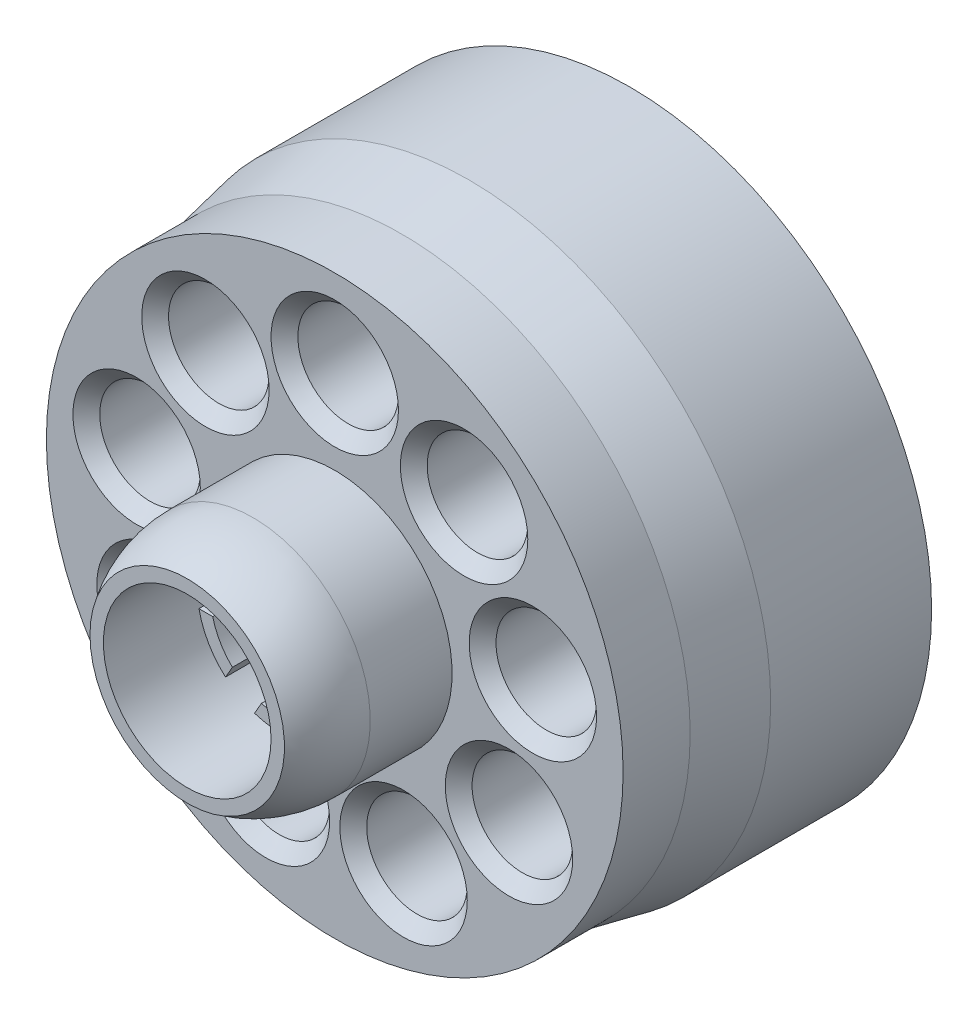
from build123d import *

# Parameters (mm, degrees)
SKETCH_1_R                           = 37.5
EXTRUDE_1_DEPTH                      = 2
SKETCH_2_R                           = 45
EXTRUDE_2_DEPTH                      = 24
SKETCH_3_R                           = 43
EXTRUDE_3_DEPTH                      = 10
SKETCH_4_R                           = 43
EXTRUDE_4_DEPTH                      = 10
SKETCH_7_R                           = 7.5
CUT_EXTRUDE_1_DEPTH                  = 36
SKETCH_8_R                           = 3
CUT_EXTRUDE_2_DEPTH                  = 87.104587567
CHAMFER_1_SIZE                       = 2
PATTERN_CIRCULAR_1_COUNT             = 9
CHAMFER_1_OF_PATTERN_CIRCULAR_1_SIZE = 2
SKETCH_9_R                           = 12.5
CUT_EXTRUDE_3_DEPTH                  = 14
CUT_EXTRUDE_4_DEPTH                  = 84.462566459
PATTERN_CIRCULAR_2_COUNT             = 3
SKETCH_11_R                          = 10.5
CUT_EXTRUDE_5_DEPTH                  = 94.134311615
SKETCH_12_R                          = 22.5
CUT_EXTRUDE_6_DEPTH                  = 2
SKETCH_13_R                          = 16
CUT_EXTRUDE_7_DEPTH                  = 3.5
SKETCH_14_R                          = 17.85
CUT_EXTRUDE_8_DEPTH                  = 1.5
SKETCH_15_R                          = 16
CUT_EXTRUDE_9_DEPTH                  = 40


# Read off the part's stored shape, not the designer's step: 边界1
with BuildPart() as part:
    # 草图1 → 凸台-拉伸1 (new body)
    with BuildSketch(Plane.XY):
        Circle(SKETCH_1_R)
    extrude(amount=EXTRUDE_1_DEPTH)

    # 草图2 → 凸台-拉伸2 (add)
    with BuildSketch(Plane.XY.offset(2)):
        Circle(SKETCH_2_R)
    extrude(amount=EXTRUDE_2_DEPTH)

    # 草图3 → 凸台-拉伸3 (add)
    with BuildSketch(Plane.XY.offset(26)):
        Circle(SKETCH_3_R)
    extrude(amount=EXTRUDE_3_DEPTH)

    # 边界1 outline → 边界1 (revolve)
    with BuildSketch(Plane.XZ):
        Polygon((45, 26), (43, 36), (43, 26), align=None)
    revolve(axis=Axis((0, 0, 0), (0, 0, 1)))

    # 草图4 → 凸台-拉伸4 (add)
    with BuildSketch(Plane.XY.offset(36)):
        Circle(SKETCH_4_R)
    extrude(amount=EXTRUDE_4_DEPTH)

    # 草图6 → 旋转1 (revolve)
    with BuildSketch(Plane(origin=(0, 0, 0), x_dir=(0, 0, -1), z_dir=(1, 0, 0)), mode=Mode.PRIVATE) as revolve_1_sk:
        with BuildLine():
            Line((-46, 0), (-46, 17.5))
            Line((-46, 17.5), (-58.202041029, 17.5))
            ThreePointArc((-58.202041029, 17.5), (-63.325516412, 16.733200531), (-68, 14.5))
            Line((-68, 14.5), (-68, 0))
            Line((-68, 0), (-46, 0))
        make_face()
    revolve(revolve_1_sk.sketch.rotate(Axis((0, 0, 46), (0, 0, 1)), 90), axis=Axis((0, 0, 46), (0, 0, 1)))

    # 草图7 → 切除-拉伸1 (cut)
    with BuildSketch(Plane.XY.offset(46)):
        with Locations((0, 30)):
            Circle(SKETCH_7_R)
    cut_extrude_1 = extrude(amount=-CUT_EXTRUDE_1_DEPTH, mode=Mode.SUBTRACT)

    # 草图8 → 切除-拉伸2 (cut, through all)
    with BuildSketch(Plane.XY.offset(10)):
        with Locations((0, 30)):
            Circle(SKETCH_8_R)
    cut_extrude_2 = extrude(amount=-CUT_EXTRUDE_2_DEPTH, mode=Mode.SUBTRACT)

    # 倒角1
    chamfer_1_edges = [part.edges().sort_by_distance(p)[0] for p in [
        (-7.5, 30, 46),
        (-3, 30, 10),
    ]]
    chamfer(chamfer_1_edges, length=CHAMFER_1_SIZE)

    # 阵列(圆周)1: 切除-拉伸1, 切除-拉伸2 ×9 about axis
    pattern_circular_1_axis = Axis((0, 0, 0), (0, 0, 1))
    add([cut_extrude_1.rotate(pattern_circular_1_axis, i * 360 / PATTERN_CIRCULAR_1_COUNT) for i in range(1, PATTERN_CIRCULAR_1_COUNT)], mode=Mode.SUBTRACT)
    add([cut_extrude_2.rotate(pattern_circular_1_axis, i * 360 / PATTERN_CIRCULAR_1_COUNT) for i in range(1, PATTERN_CIRCULAR_1_COUNT)], mode=Mode.SUBTRACT)

    # 倒角1 of 阵列(圆周)1
    chamfer_1_of_pattern_circular_1_edges = [part.edges().sort_by_distance(p)[0] for p in [
        (-25.028961614, 18.160426221, 46),
        (-21.58176162, 21.052970465, 10),
        (-30.846593923, -2.176612818, 46),
        (-30.065177123, 2.255022071, 10),
        (-22.230762114, -21.495190528, 46),
        (-24.480762114, -17.598076211, 10),
        (-3.212909644, -30.755929699, 46),
        (-7.441526437, -29.216839054, 10),
        (17.308298956, -25.625627549, 46),
        (13.079682162, -27.164718194, 10),
        (29.730762114, -8.504809472, 46),
        (27.480762114, -12.401923789, 10),
        (28.241871258, 12.595503478, 46),
        (29.023288057, 8.163868589, 10),
        (13.538294967, 27.802240366, 46),
        (16.985494961, 24.909696123, 10),
    ]]
    chamfer(chamfer_1_of_pattern_circular_1_edges, length=CHAMFER_1_OF_PATTERN_CIRCULAR_1_SIZE)

    # 草图9 → 切除-拉伸3 (cut)
    with BuildSketch(Plane.XY.offset(68)):
        Circle(SKETCH_9_R)
    extrude(amount=-CUT_EXTRUDE_3_DEPTH, mode=Mode.SUBTRACT)

    # 草图10 → 切除-拉伸4 (cut, through all)
    with BuildSketch(Plane.XY.offset(54)):
        with BuildLine():
            Line((-12.247448714, -2.5), (12.247448714, -2.5))
            ThreePointArc((12.247448714, -2.5), (12.5, 0), (12.247448714, 2.5))
            Line((12.247448714, 2.5), (-12.247448714, 2.5))
            ThreePointArc((-12.247448714, 2.5), (-12.5, 0), (-12.247448714, -2.5))
        make_face()
    cut_extrude_4 = extrude(amount=-CUT_EXTRUDE_4_DEPTH, mode=Mode.SUBTRACT)

    # 阵列(圆周)2: 切除-拉伸4 ×3 about axis
    pattern_circular_2_axis = Axis((0, 0, 0), (0, 0, 1))
    for i in range(1, PATTERN_CIRCULAR_2_COUNT):
        add(cut_extrude_4.rotate(pattern_circular_2_axis, i * 360 / PATTERN_CIRCULAR_2_COUNT), mode=Mode.SUBTRACT)

    # 草图11 → 切除-拉伸5 (cut, through all)
    with BuildSketch(Plane.XY.offset(68)):
        Circle(SKETCH_11_R)
    extrude(amount=-CUT_EXTRUDE_5_DEPTH, mode=Mode.SUBTRACT)

    # 草图12 → 切除-拉伸6 (cut)
    with BuildSketch(Plane(origin=(0, 0, 0), x_dir=(-1, 0, 0), z_dir=(0, 0, -1))):
        Circle(SKETCH_12_R)
    extrude(amount=-CUT_EXTRUDE_6_DEPTH, mode=Mode.SUBTRACT)

    # 草图13 → 切除-拉伸7 (cut)
    with BuildSketch(Plane(origin=(0, 0, 2), x_dir=(-1, 0, 0), z_dir=(0, 0, -1))):
        Circle(SKETCH_13_R)
    extrude(amount=-CUT_EXTRUDE_7_DEPTH, mode=Mode.SUBTRACT)

    # 草图14 → 切除-拉伸8 (cut)
    with BuildSketch(Plane(origin=(0, 0, 5.5), x_dir=(-1, 0, 0), z_dir=(0, 0, -1))):
        Circle(SKETCH_14_R)
    extrude(amount=-CUT_EXTRUDE_8_DEPTH, mode=Mode.SUBTRACT)

    # 草图15 → 切除-拉伸9 (cut)
    with BuildSketch(Plane(origin=(0, 0, 0), x_dir=(-1, 0, 0), z_dir=(0, 0, -1))):
        Circle(SKETCH_15_R)
    extrude(amount=-CUT_EXTRUDE_9_DEPTH, mode=Mode.SUBTRACT)


solid = part.part
